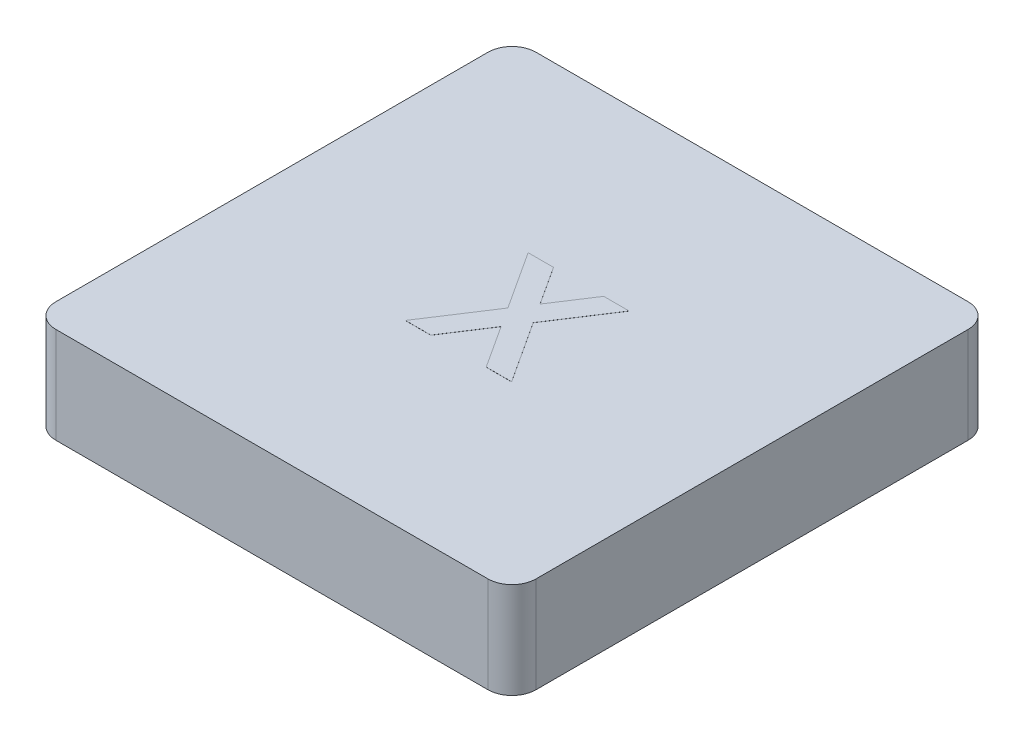
from build123d import *

# Parameters (mm, degrees)
SKETCH1_W           = 12.7
SKETCH1_H           = 12.7
BOSS_EXTRUDE1_DEPTH = 2.54
FILLET1_R           = 0.635
SHELL1_START        = 0.635
SHELL1_OUTLINE_W    = 1.905
SHELL1_OUTLINE_H    = 11.43
SHELL1_DEPTH        = 11.43
SKETCH2_R           = 2.54
BOSS_EXTRUDE2_DEPTH = 1.905
BOSS_EXTRUDE3_DEPTH = 0.00254


# Read off the part's stored shape, not the designer's step: Shell1
with BuildPart() as part:
    # Sketch1 → Boss-Extrude1 (new body)
    with BuildSketch(Plane(origin=(0, 0, 0), x_dir=(1, 0, 0), z_dir=(0, 1, 0))):
        with Locations((6.35, 6.35)):
            Rectangle(SKETCH1_W, SKETCH1_H)
    extrude(amount=BOSS_EXTRUDE1_DEPTH)

    # Fillet1
    fillet1_edges = [part.edges().sort_by_distance(p)[0] for p in [
        (0, 1.27, -12.7),
        (12.7, 1.27, -12.7),
        (12.7, 1.27, 0),
        (0, 1.27, 0),
    ]]
    fillet(fillet1_edges, radius=FILLET1_R)

    # Shell1 outline → Shell1 (cut)
    with BuildSketch(Plane.YZ.offset(SHELL1_START)):
        with Locations((0.9525, -6.35)):
            Rectangle(SHELL1_OUTLINE_W, SHELL1_OUTLINE_H)
    extrude(amount=SHELL1_DEPTH, mode=Mode.SUBTRACT)

    # Sketch2 → Boss-Extrude2 (add)
    with BuildSketch(Plane(origin=(0, 1.905, 0), x_dir=(-1, 0, 0), z_dir=(0, -1, 0))):
        with Locations(Location((-6.35, 6.35, 0), (0, 0, 270))):
            Circle(SKETCH2_R)
    extrude(amount=BOSS_EXTRUDE2_DEPTH)

    # Sketch3 → Boss-Extrude3 (add)
    with BuildSketch(Plane(origin=(0, 2.54, 0), x_dir=(1, 0, 0), z_dir=(0, 1, 0))):
        Polygon((5.125360777, 8.001), (5.796995393, 8.001), (6.460361779, 6.981463742), (7.1250002, 8.001), (7.797270833, 8.001), (6.796179087, 6.465653446), (7.863416667, 4.826), (7.191782051, 4.826), (6.460361779, 5.950479167), (5.727033454, 4.826), (5.054762821, 4.826), (6.124544471, 6.466289463), align=None)
    extrude(amount=BOSS_EXTRUDE3_DEPTH)


solid = part.part
